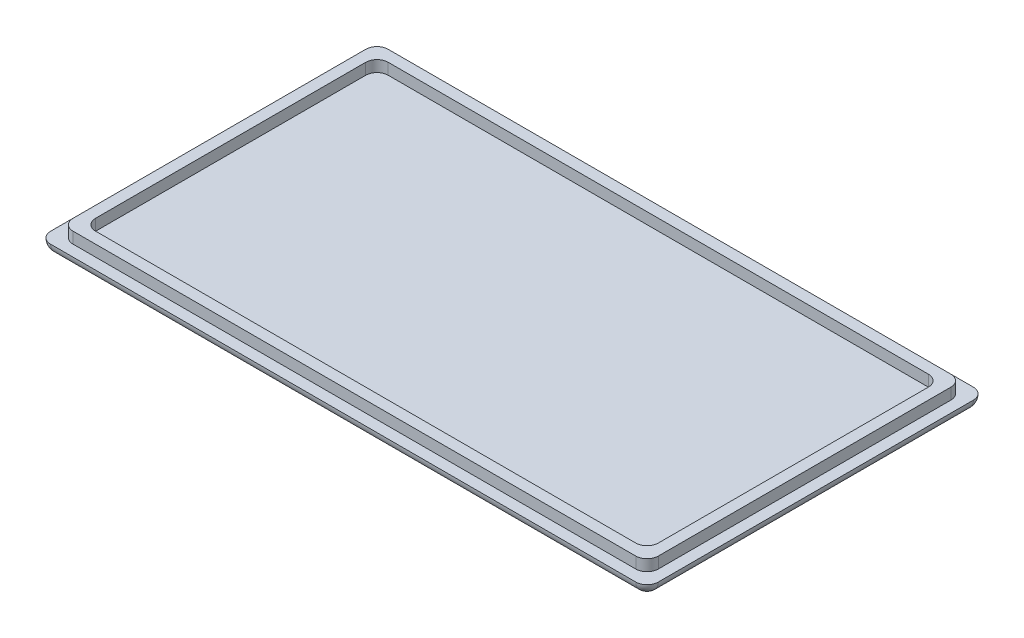
from build123d import *

# Parameters (mm, degrees)
SKETCH1_W           = 270
SKETCH1_H           = 150
BOSS_EXTRUDE2_DEPTH = 5
SKETCH4_W           = 260
SKETCH4_H           = 140
SKETCH4_W_2         = 250
SKETCH4_H_2         = 130
BOSS_EXTRUDE3_DEPTH = 5
FILLET1_R           = 5


with BuildPart() as part:
    # Sketch1 → Boss-Extrude2 (new body)
    with BuildSketch(Plane(origin=(0, 0, 0), x_dir=(1, 0, 0), z_dir=(0, 1, 0))):
        Rectangle(SKETCH1_W, SKETCH1_H)
    extrude(amount=BOSS_EXTRUDE2_DEPTH)

    # Sketch4 → Boss-Extrude3 (add)
    with BuildSketch(Plane(origin=(0, 5, 0), x_dir=(1, 0, 0), z_dir=(0, 1, 0))):
        Rectangle(SKETCH4_W, SKETCH4_H)
        Rectangle(SKETCH4_W_2, SKETCH4_H_2, mode=Mode.SUBTRACT)
    extrude(amount=BOSS_EXTRUDE3_DEPTH)

    # Fillet1
    fillet1_edges = [part.edges().sort_by_distance(p)[0] for p in [
        (-130, 7.5, 70),
        (130, 7.5, 70),
        (130, 7.5, -70),
        (-130, 7.5, -70),
        (-125, 7.5, -65),
        (-125, 7.5, 65),
        (125, 7.5, 65),
        (125, 7.5, -65),
        (0, 0, 75),
        (-135, 0, 0),
        (0, 0, -75),
        (135, 0, 0),
        (135, 2.5, 75),
        (-135, 2.5, 75),
        (-135, 2.5, -75),
        (135, 2.5, -75),
    ]]
    fillet(fillet1_edges, radius=FILLET1_R - 0.0001)  # a hair under: the kernel refuses the full size


solid = part.part
